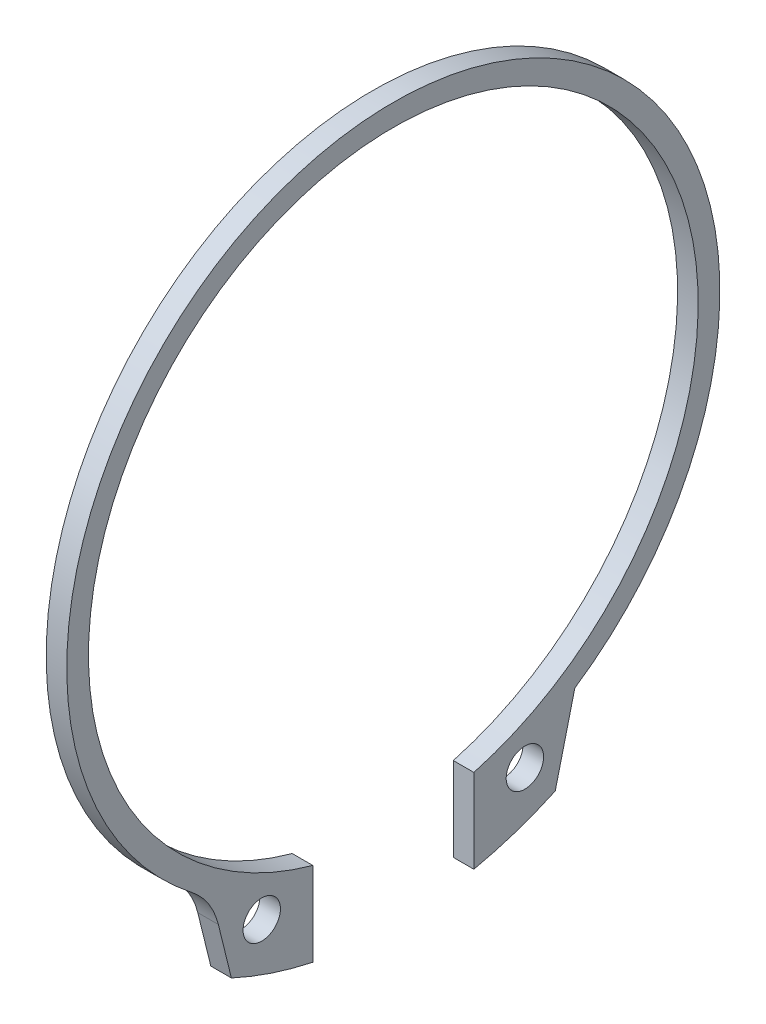
from build123d import *

# Parameters (mm, degrees)
ESQUISSE1_R        = 2.5
BOSS_EXTRU_1_DEPTH = 2.75


with BuildPart() as part:
    # Esquisse1 → Boss.-Extru.1 (new body)
    with BuildSketch(Plane(origin=(0, 0, 0), x_dir=(0, 0, -1), z_dir=(1, 0, 0))):
        with BuildLine():
            Line((-10.766267997, -50.51544292), (-10.766267997, -39.302035233))
            ThreePointArc((-10.766267997, -39.302035233), (0, 40.75), (10.766267997, -39.302035233))
            Line((10.766267997, -39.302035233), (10.766267997, -50.51544292))
            ThreePointArc((10.766267997, -50.51544292), (16.306081888, -49.008511439), (21.644430048, -46.89606751))
            Line((21.644430048, -46.89606751), (23.387305308, -39.830230478))
            Line((23.387305308, -39.830230478), (24.261424451, -36.286440768))
            ThreePointArc((24.261424451, -36.286440768), (25.612621221, -35.345666413), (26.927377749, -34.354604169))
            ThreePointArc((26.927377749, -34.354604169), (0, 43.65), (-26.927377749, -34.354604169))
            ThreePointArc((-26.927377749, -34.354604169), (-24.698521976, -36.795783777), (-23.387305308, -39.830230478))
            Line((-23.387305308, -39.830230478), (-21.644430048, -46.89606751))
            ThreePointArc((-21.644430048, -46.89606751), (-16.306081888, -49.008511439), (-10.766267997, -50.51544292))
        make_face()
        with Locations((-17.586926608, -42.155638936)):
            Circle(ESQUISSE1_R, mode=Mode.SUBTRACT)
        with Locations((17.586926608, -42.155638936)):
            Circle(ESQUISSE1_R, mode=Mode.SUBTRACT)
    extrude(amount=BOSS_EXTRU_1_DEPTH)


solid = part.part
